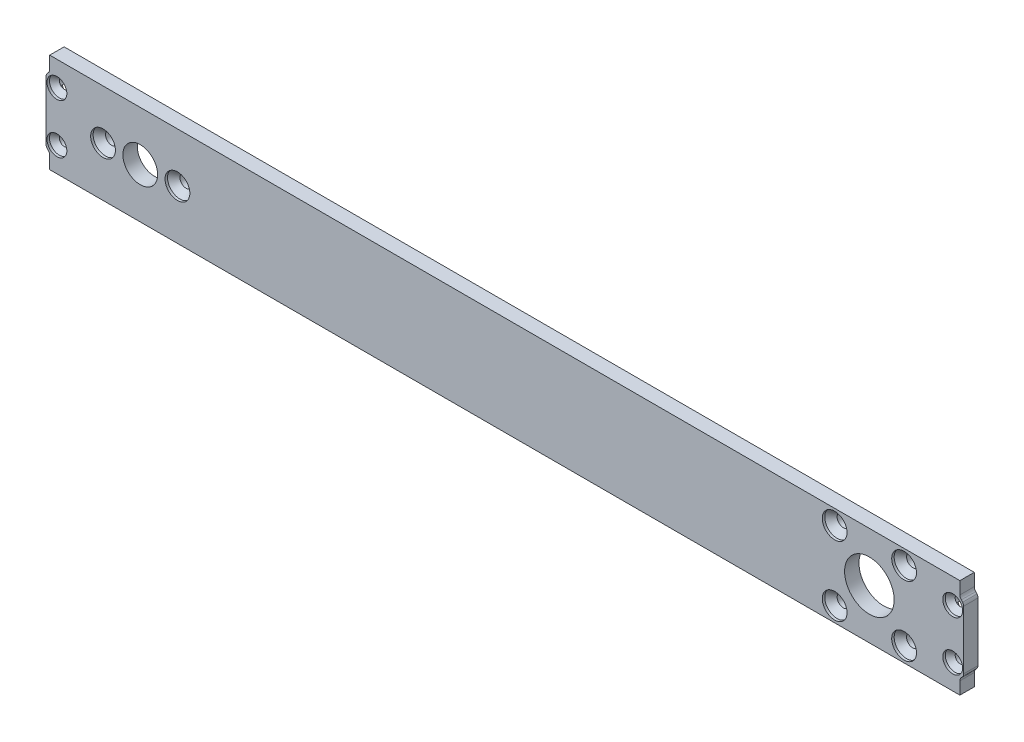
from build123d import *

# Parameters (mm, degrees)
SKETCH1_W                                      = 185
SKETCH1_H                                      = 20
BASE_SHAPE_DEPTH                               = 2.9
MOTOR_CUTOUTS_REACH                            = 95.084
SKETCH2_R                                      = 1.25
SKETCH2_R_2                                    = 3.5
SKETCH2_R_3                                    = 5
MOTOR_M2_5_COUNTERSUNKS_AT_2_COUNT             = 2
MOTOR_M2_5_COUNTERSUNKS_AT_2_PITCH             = 15
MOTOR_M2_5_COUNTERSUNKS_AT_3_COUNT             = 2
MOTOR_M2_5_COUNTERSUNKS_AT_3_PITCH             = 147.666008275
MOTOR_M2_5_COUNTERSUNKS_AT_4_COUNT             = 2
MOTOR_M2_5_COUNTERSUNKS_AT_4_PITCH             = 161.651631603
MOTOR_M2_5_COUNTERSUNKS_AT_5_COUNT             = 2
MOTOR_M2_5_COUNTERSUNKS_AT_5_PITCH             = 147.666008275
MOTOR_M2_5_COUNTERSUNKS_AT_6_COUNT             = 2
MOTOR_M2_5_COUNTERSUNKS_AT_6_PITCH             = 161.651631603
PCB_SLOT_DEPTH                                 = 0.775
END_PLATE_HOLES_REACH                          = 95.084
SKETCH6_R                                      = 1
CSK_FOR_M2_FLAT_HEAD_MACHINE_SCREW3_AT_2_COUNT = 2
CSK_FOR_M2_FLAT_HEAD_MACHINE_SCREW3_AT_2_PITCH = 10
CSK_FOR_M2_FLAT_HEAD_MACHINE_SCREW3_AT_3_COUNT = 2
CSK_FOR_M2_FLAT_HEAD_MACHINE_SCREW3_AT_3_PITCH = 180.6
CSK_FOR_M2_FLAT_HEAD_MACHINE_SCREW3_AT_4_COUNT = 2
CSK_FOR_M2_FLAT_HEAD_MACHINE_SCREW3_AT_4_PITCH = 180.876643047
TAP_START                                      = -1.4
TAP_SLOTS_DEPTH                                = 1.4
CUT_EXTRUDE3_REACH                             = 95.084
FILLET1_R                                      = 1


with BuildPart() as part:
    # Sketch1 → Base shape (new body)
    with BuildSketch(Plane.XY):
        Rectangle(SKETCH1_W, SKETCH1_H)
    extrude(amount=-BASE_SHAPE_DEPTH)

    # Sketch2 → Motor cutouts (cut, up to next)
    with BuildSketch(Plane.XY, mode=Mode.PRIVATE) as motor_cutouts_sk1:
        with Locations((-81, 0)):
            Circle(SKETCH2_R)
    motor_cutouts_tool1 = extrude(motor_cutouts_sk1.sketch, amount=-MOTOR_CUTOUTS_REACH, mode=Mode.PRIVATE) & part.part
    # Sketch2 → Motor cutouts (cut, up to next)
    with BuildSketch(Plane.XY, mode=Mode.PRIVATE) as motor_cutouts_sk2:
        with Locations((-66, 0)):
            Circle(SKETCH2_R)
    motor_cutouts_tool2 = extrude(motor_cutouts_sk2.sketch, amount=-MOTOR_CUTOUTS_REACH, mode=Mode.PRIVATE) & part.part
    # Sketch2 → Motor cutouts (cut, up to next)
    with BuildSketch(Plane.XY, mode=Mode.PRIVATE) as motor_cutouts_sk3:
        with Locations((-73.5, 0)):
            Circle(SKETCH2_R_2)
    motor_cutouts_tool3 = extrude(motor_cutouts_sk3.sketch, amount=-MOTOR_CUTOUTS_REACH, mode=Mode.PRIVATE) & part.part
    # Sketch2 → Motor cutouts (cut, up to next)
    with BuildSketch(Plane.XY, mode=Mode.PRIVATE) as motor_cutouts_sk4:
        with Locations((73.5, 0)):
            Circle(SKETCH2_R_3)
    motor_cutouts_tool4 = extrude(motor_cutouts_sk4.sketch, amount=-MOTOR_CUTOUTS_REACH, mode=Mode.PRIVATE) & part.part
    # Sketch2 → Motor cutouts (cut, up to next)
    with BuildSketch(Plane.XY, mode=Mode.PRIVATE) as motor_cutouts_sk5:
        with Locations((66.5, 7)):
            Circle(SKETCH2_R)
    motor_cutouts_tool5 = extrude(motor_cutouts_sk5.sketch, amount=-MOTOR_CUTOUTS_REACH, mode=Mode.PRIVATE) & part.part
    # Sketch2 → Motor cutouts (cut, up to next)
    with BuildSketch(Plane.XY, mode=Mode.PRIVATE) as motor_cutouts_sk6:
        with Locations((80.5, 7)):
            Circle(SKETCH2_R)
    motor_cutouts_tool6 = extrude(motor_cutouts_sk6.sketch, amount=-MOTOR_CUTOUTS_REACH, mode=Mode.PRIVATE) & part.part
    # Sketch2 → Motor cutouts (cut, up to next)
    with BuildSketch(Plane.XY, mode=Mode.PRIVATE) as motor_cutouts_sk7:
        with Locations((80.5, -7)):
            Circle(SKETCH2_R)
    motor_cutouts_tool7 = extrude(motor_cutouts_sk7.sketch, amount=-MOTOR_CUTOUTS_REACH, mode=Mode.PRIVATE) & part.part
    # Sketch2 → Motor cutouts (cut, up to next)
    with BuildSketch(Plane.XY, mode=Mode.PRIVATE) as motor_cutouts_sk8:
        with Locations((66.5, -7)):
            Circle(SKETCH2_R)
    motor_cutouts_tool8 = extrude(motor_cutouts_sk8.sketch, amount=-MOTOR_CUTOUTS_REACH, mode=Mode.PRIVATE) & part.part
    add(motor_cutouts_tool1.solids().sort_by_distance((-81, 0, 0))[0], mode=Mode.SUBTRACT)
    add(motor_cutouts_tool2.solids().sort_by_distance((-66, 0, 0))[0], mode=Mode.SUBTRACT)
    add(motor_cutouts_tool3.solids().sort_by_distance((-73.5, 0, 0))[0], mode=Mode.SUBTRACT)
    add(motor_cutouts_tool4.solids().sort_by_distance((73.5, 0, 0))[0], mode=Mode.SUBTRACT)
    add(motor_cutouts_tool5.solids().sort_by_distance((66.5, 7, 0))[0], mode=Mode.SUBTRACT)
    add(motor_cutouts_tool6.solids().sort_by_distance((80.5, 7, 0))[0], mode=Mode.SUBTRACT)
    add(motor_cutouts_tool7.solids().sort_by_distance((80.5, -7, 0))[0], mode=Mode.SUBTRACT)
    add(motor_cutouts_tool8.solids().sort_by_distance((66.5, -7, 0))[0], mode=Mode.SUBTRACT)

    # Sketch4 → Motor M2.5 countersunks (revolve, cut)
    with BuildSketch(Plane(origin=(-81, 0, 0), x_dir=(0, -1, 0), z_dir=(1, 0, 0))):
        Polygon((0, 0), (0, 2.9), (1.25, 2.9), (1.25, 1.75), (2.5, 0.5), (2.5, 0), align=None)
    motor_m2_5_countersunks = revolve(axis=Axis((-81, 0, 6.35), (0, 0, -1)), mode=Mode.SUBTRACT)

    # Motor M2.5 countersunks at 2: Motor M2.5 countersunks ×2
    with Locations(*[(i * MOTOR_M2_5_COUNTERSUNKS_AT_2_PITCH, 0, 0) for i in range(1, MOTOR_M2_5_COUNTERSUNKS_AT_2_COUNT)]):
        add(motor_m2_5_countersunks, mode=Mode.SUBTRACT)

    # Motor M2.5 countersunks at 3: Motor M2.5 countersunks ×2
    with Locations(*[Vector(0.9988757854473691, 0.047404274563603965, 0) * (i * MOTOR_M2_5_COUNTERSUNKS_AT_3_PITCH) for i in range(1, MOTOR_M2_5_COUNTERSUNKS_AT_3_COUNT)]):
        add(motor_m2_5_countersunks, mode=Mode.SUBTRACT)

    # Motor M2.5 countersunks at 4: Motor M2.5 countersunks ×2
    with Locations(*[Vector(0.9990619853213468, 0.043302996267798335, 0) * (i * MOTOR_M2_5_COUNTERSUNKS_AT_4_PITCH) for i in range(1, MOTOR_M2_5_COUNTERSUNKS_AT_4_COUNT)]):
        add(motor_m2_5_countersunks, mode=Mode.SUBTRACT)

    # Motor M2.5 countersunks at 5: Motor M2.5 countersunks ×2
    with Locations(*[Vector(0.9988757854473691, -0.04740427456360395, 0) * (i * MOTOR_M2_5_COUNTERSUNKS_AT_5_PITCH) for i in range(1, MOTOR_M2_5_COUNTERSUNKS_AT_5_COUNT)]):
        add(motor_m2_5_countersunks, mode=Mode.SUBTRACT)

    # Motor M2.5 countersunks at 6: Motor M2.5 countersunks ×2
    with Locations(*[Vector(0.9990619853213468, -0.0433029962677983, 0) * (i * MOTOR_M2_5_COUNTERSUNKS_AT_6_PITCH) for i in range(1, MOTOR_M2_5_COUNTERSUNKS_AT_6_COUNT)]):
        add(motor_m2_5_countersunks, mode=Mode.SUBTRACT)

    # Sketch5 → PCB slot (cut)
    with BuildSketch(Plane(origin=(0, 0, -2.9), x_dir=(-1, 0, 0), z_dir=(0, 0, -1))):
        with BuildLine():
            Line((-60, -6), (60, -6))
            ThreePointArc((60, -6), (61, -7), (60, -8))
            Line((60, -8), (-60, -8))
            ThreePointArc((-60, -8), (-61, -7), (-60, -6))
        make_face()
    extrude(amount=-PCB_SLOT_DEPTH, mode=Mode.SUBTRACT)

    # Sketch6 → End plate holes (cut, up to next)
    with BuildSketch(Plane.XY, mode=Mode.PRIVATE) as end_plate_holes_sk1:
        with Locations((90.3, 5)):
            Circle(SKETCH6_R)
    end_plate_holes_tool1 = extrude(end_plate_holes_sk1.sketch, amount=-END_PLATE_HOLES_REACH, mode=Mode.PRIVATE) & part.part
    # Sketch6 → End plate holes (cut, up to next)
    with BuildSketch(Plane.XY, mode=Mode.PRIVATE) as end_plate_holes_sk2:
        with Locations((90.3, -5)):
            Circle(SKETCH6_R)
    end_plate_holes_tool2 = extrude(end_plate_holes_sk2.sketch, amount=-END_PLATE_HOLES_REACH, mode=Mode.PRIVATE) & part.part
    # Sketch6 → End plate holes (cut, up to next)
    with BuildSketch(Plane.XY, mode=Mode.PRIVATE) as end_plate_holes_sk3:
        with Locations((-90.3, -5)):
            Circle(SKETCH6_R)
    end_plate_holes_tool3 = extrude(end_plate_holes_sk3.sketch, amount=-END_PLATE_HOLES_REACH, mode=Mode.PRIVATE) & part.part
    # Sketch6 → End plate holes (cut, up to next)
    with BuildSketch(Plane.XY, mode=Mode.PRIVATE) as end_plate_holes_sk4:
        with Locations((-90.3, 5)):
            Circle(SKETCH6_R)
    end_plate_holes_tool4 = extrude(end_plate_holes_sk4.sketch, amount=-END_PLATE_HOLES_REACH, mode=Mode.PRIVATE) & part.part
    add(end_plate_holes_tool1.solids().sort_by_distance((90.3, 5, 0))[0], mode=Mode.SUBTRACT)
    add(end_plate_holes_tool2.solids().sort_by_distance((90.3, -5, 0))[0], mode=Mode.SUBTRACT)
    add(end_plate_holes_tool3.solids().sort_by_distance((-90.3, -5, 0))[0], mode=Mode.SUBTRACT)
    add(end_plate_holes_tool4.solids().sort_by_distance((-90.3, 5, 0))[0], mode=Mode.SUBTRACT)

    # Sketch9 → CSK for M2 Flat Head Machine Screw3 (revolve, cut)
    with BuildSketch(Plane(origin=(90.3, 5, 0), x_dir=(0, -1, 0), z_dir=(1, 0, 0))):
        Polygon((0, 0), (0, 2.9), (1, 2.9), (1, 1.5), (2, 0.5), (2, 0), align=None)
    csk_for_m2_flat_head_machine_screw3 = revolve(axis=Axis((90.3, 5, 6.35), (0, 0, -1)), mode=Mode.SUBTRACT)

    # CSK for M2 Flat Head Machine Screw3 at 2: CSK for M2 Flat Head Machine Screw3 ×2
    with Locations(*[(0, -i * CSK_FOR_M2_FLAT_HEAD_MACHINE_SCREW3_AT_2_PITCH, 0) for i in range(1, CSK_FOR_M2_FLAT_HEAD_MACHINE_SCREW3_AT_2_COUNT)]):
        add(csk_for_m2_flat_head_machine_screw3, mode=Mode.SUBTRACT)

    # CSK for M2 Flat Head Machine Screw3 at 3: CSK for M2 Flat Head Machine Screw3 ×2
    with Locations(*[(-i * CSK_FOR_M2_FLAT_HEAD_MACHINE_SCREW3_AT_3_PITCH, 0, 0) for i in range(1, CSK_FOR_M2_FLAT_HEAD_MACHINE_SCREW3_AT_3_COUNT)]):
        add(csk_for_m2_flat_head_machine_screw3, mode=Mode.SUBTRACT)

    # CSK for M2 Flat Head Machine Screw3 at 4: CSK for M2 Flat Head Machine Screw3 ×2
    with Locations(*[Vector(-0.9984705430039356, -0.055286298062233535, 0) * (i * CSK_FOR_M2_FLAT_HEAD_MACHINE_SCREW3_AT_4_PITCH) for i in range(1, CSK_FOR_M2_FLAT_HEAD_MACHINE_SCREW3_AT_4_COUNT)]):
        add(csk_for_m2_flat_head_machine_screw3, mode=Mode.SUBTRACT)

    # Sketch12 → Tap slots (cut)
    with BuildSketch(Plane(origin=(0, 0, -2.9), x_dir=(-1, 0, 0), z_dir=(0, 0, -1)).offset(TAP_START)):
        with BuildLine():
            ThreePointArc((-91.003038379, 4.288848091), (-91.998627583, 3.716739018), (-91.8, 2.585786438))
            Line((-91.8, 2.585786438), (-91.8, -2.585786438))
            ThreePointArc((-91.8, -2.585786438), (-91.998627583, -3.716739018), (-91.003038379, -4.288848091))
            ThreePointArc((-91.003038379, -4.288848091), (-90.3, -6), (-89.596961621, -4.288848091))
            ThreePointArc((-89.596961621, -4.288848091), (-88.601372417, -3.716739018), (-88.8, -2.585786438))
            Line((-88.8, -2.585786438), (-88.8, 2.585786438))
            ThreePointArc((-88.8, 2.585786438), (-88.601372417, 3.716739018), (-89.596961621, 4.288848091))
            ThreePointArc((-89.596961621, 4.288848091), (-90.3, 6), (-91.003038379, 4.288848091))
        make_face()
        with BuildLine():
            ThreePointArc((91.003038379, -4.288848091), (91.998627583, -3.716739018), (91.8, -2.585786438))
            Line((91.8, -2.585786438), (91.8, 2.585786438))
            ThreePointArc((91.8, 2.585786438), (91.998627583, 3.716739018), (91.003038379, 4.288848091))
            ThreePointArc((91.003038379, 4.288848091), (90.3, 6), (89.596961621, 4.288848091))
            ThreePointArc((89.596961621, 4.288848091), (88.601372417, 3.716739018), (88.8, 2.585786438))
            Line((88.8, 2.585786438), (88.8, -2.585786438))
            ThreePointArc((88.8, -2.585786438), (88.601372417, -3.716739018), (89.596961621, -4.288848091))
            ThreePointArc((89.596961621, -4.288848091), (90.3, -6), (91.003038379, -4.288848091))
        make_face()
    extrude(amount=TAP_SLOTS_DEPTH, mode=Mode.SUBTRACT)

    # Sketch13 → Cut-Extrude3 (cut, up to next)
    with BuildSketch(Plane.XY, mode=Mode.PRIVATE) as cut_extrude3_sk1:
        with BuildLine():
            Line((-91.75, 10), (-92.5, 10))
            Line((-92.5, 10), (-92.5, 6.187434209))
            ThreePointArc((-92.5, 6.187434209), (-92.173731748, 6.655031521), (-91.75, 7.036541185))
            Line((-91.75, 7.036541185), (-91.75, 10))
        make_face()
    cut_extrude3_tool1 = extrude(cut_extrude3_sk1.sketch, amount=-CUT_EXTRUDE3_REACH, mode=Mode.PRIVATE) & part.part
    # Sketch13 → Cut-Extrude3 (cut, up to next)
    with BuildSketch(Plane.XY, mode=Mode.PRIVATE) as cut_extrude3_sk2:
        with BuildLine():
            Line((92.5, 10), (91.75, 10))
            Line((91.75, 10), (91.75, 7.036541185))
            ThreePointArc((91.75, 7.036541185), (92.173731748, 6.655031521), (92.5, 6.187434209))
            Line((92.5, 6.187434209), (92.5, 10))
        make_face()
    cut_extrude3_tool2 = extrude(cut_extrude3_sk2.sketch, amount=-CUT_EXTRUDE3_REACH, mode=Mode.PRIVATE) & part.part
    # Sketch13 → Cut-Extrude3 (cut, up to next)
    with BuildSketch(Plane.XY, mode=Mode.PRIVATE) as cut_extrude3_sk3:
        with BuildLine():
            ThreePointArc((-91.75, -7.036541185), (-92.173731748, -6.655031521), (-92.5, -6.187434209))
            Line((-92.5, -6.187434209), (-92.5, -10))
            Line((-92.5, -10), (-91.75, -10))
            Line((-91.75, -10), (-91.75, -7.036541185))
        make_face()
    cut_extrude3_tool3 = extrude(cut_extrude3_sk3.sketch, amount=-CUT_EXTRUDE3_REACH, mode=Mode.PRIVATE) & part.part
    # Sketch13 → Cut-Extrude3 (cut, up to next)
    with BuildSketch(Plane.XY, mode=Mode.PRIVATE) as cut_extrude3_sk4:
        with BuildLine():
            ThreePointArc((92.5, -6.187434209), (92.173731748, -6.655031521), (91.75, -7.036541185))
            Line((91.75, -7.036541185), (91.75, -10))
            Line((91.75, -10), (92.5, -10))
            Line((92.5, -10), (92.5, -6.187434209))
        make_face()
    cut_extrude3_tool4 = extrude(cut_extrude3_sk4.sketch, amount=-CUT_EXTRUDE3_REACH, mode=Mode.PRIVATE) & part.part
    add(cut_extrude3_tool1.solids().sort_by_distance((-92.140588, 8.330084, 0))[0], mode=Mode.SUBTRACT)
    add(cut_extrude3_tool2.solids().sort_by_distance((92.140588, 8.330084, 0))[0], mode=Mode.SUBTRACT)
    add(cut_extrude3_tool3.solids().sort_by_distance((-92.140588, -8.330084, 0))[0], mode=Mode.SUBTRACT)
    add(cut_extrude3_tool4.solids().sort_by_distance((92.140588, -8.330084, 0))[0], mode=Mode.SUBTRACT)

    # Fillet1
    fillet1_edges = [part.edges().sort_by_distance(p)[0] for p in [
        (-91.75, -7.036541185, -1.45),
        (-92.5, -6.187434209, -1.45),
        (-92.5, 6.187434209, -1.45),
        (-91.75, 7.036541185, -1.45),
        (92.5, 6.187434209, -1.45),
        (91.75, 7.036541185, -1.45),
        (92.5, -6.187434209, -1.45),
        (91.75, -7.036541185, -1.45),
    ]]
    fillet(fillet1_edges, radius=FILLET1_R)


solid = part.part
